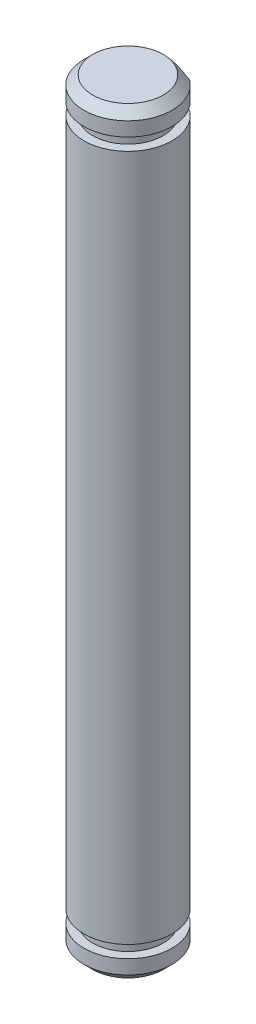
from build123d import *

# Parameters (mm, degrees)
SKETCH1_R           = 2.5
BOSS_EXTRUDE1_DEPTH = 43
CUT_EXTRUDE1_DEPTH  = 74.998233143
CHAMFER1_SIZE       = 0.5
SKETCH4_W           = 0.787433245
SKETCH4_H           = 0.7


with BuildPart() as part:
    # Sketch1 → Boss-Extrude1 (new body)
    with BuildSketch(Plane(origin=(0, 0, 0), x_dir=(1, 0, 0), z_dir=(0, 1, 0))):
        with Locations(Location((-51.989020711, -23.145372492, 0), (0, 0, 270))):
            Circle(SKETCH1_R)
    extrude(amount=BOSS_EXTRUDE1_DEPTH)

    # Sketch2 → Cut-Extrude1 (cut, through all)
    with BuildSketch(Plane(origin=(0, 43, 0), x_dir=(1, 0, 0), z_dir=(0, 1, 0))):
        with BuildLine():
            Line((-50.48434428, -21.145372492), (-53.493697142, -21.145372492))
            ThreePointArc((-53.493697142, -21.145372492), (-51.989020711, -20.642563837), (-50.48434428, -21.145372492))
        make_face()
    extrude(amount=-CUT_EXTRUDE1_DEPTH, mode=Mode.SUBTRACT)

    # Chamfer1
    chamfer1_edges = [part.edges().sort_by_distance(p)[0] for p in [
        (-51.989020711, 43, 25.645372492),
        (-51.989020711, 0, 25.645372492),
    ]]
    chamfer(chamfer1_edges, length=CHAMFER1_SIZE - 0.0001)  # a hair under: the kernel refuses the full size

    # Sketch4 → Cut-Revolve6 (revolve, cut)
    with BuildSketch(Plane.XY.offset(23.145372492), mode=Mode.PRIVATE) as cut_revolve6_sk:
        with Locations((-54.382737334, 41.35)):
            Rectangle(SKETCH4_W, SKETCH4_H)
        with Locations((-54.382737334, 1.65)):
            Rectangle(SKETCH4_W, SKETCH4_H)
    revolve(cut_revolve6_sk.sketch.rotate(Axis((-51.989020711, 43, 23.145372492), (0, -1, 0)), 90), axis=Axis((-51.989020711, 43, 23.145372492), (0, -1, 0)), mode=Mode.SUBTRACT)


solid = part.part
